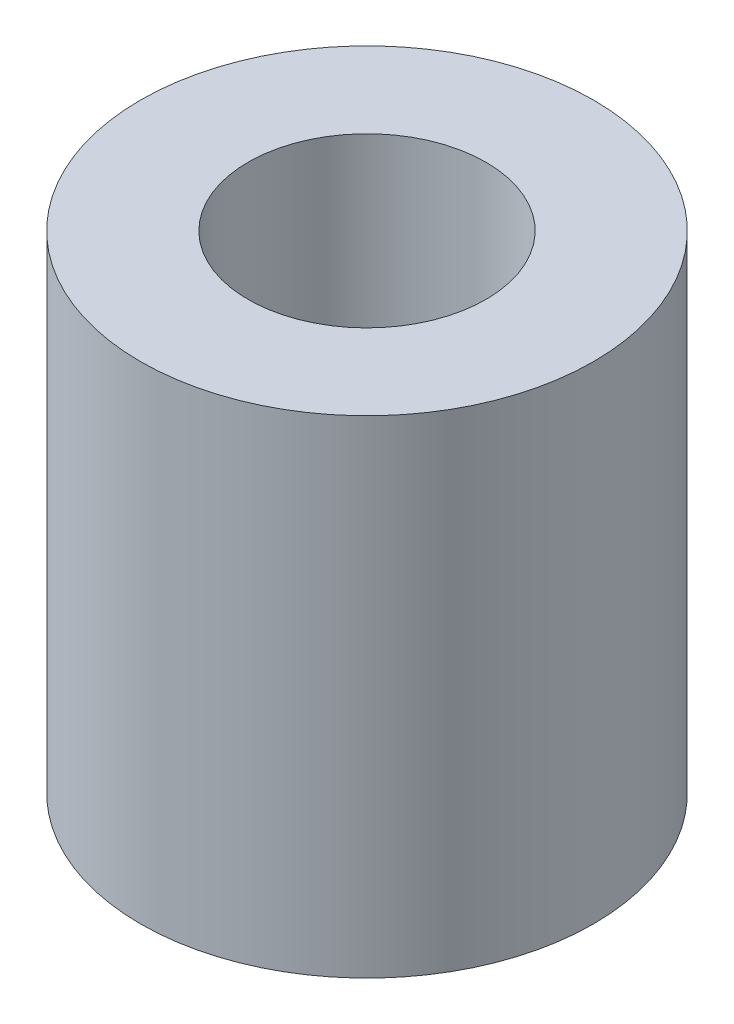
from build123d import *

# Parameters (mm, degrees)
SKETCH1_R           = 4
SKETCH1_R_2         = 2.1
BOSS_EXTRUDE1_DEPTH = 8.6


with BuildPart() as part:
    # Sketch1 → Boss-Extrude1 (new body)
    with BuildSketch(Plane(origin=(0, 0, 0), x_dir=(1, 0, 0), z_dir=(0, 1, 0))):
        Circle(SKETCH1_R)
        Circle(SKETCH1_R_2, mode=Mode.SUBTRACT)
    extrude(amount=BOSS_EXTRUDE1_DEPTH)


solid = part.part
